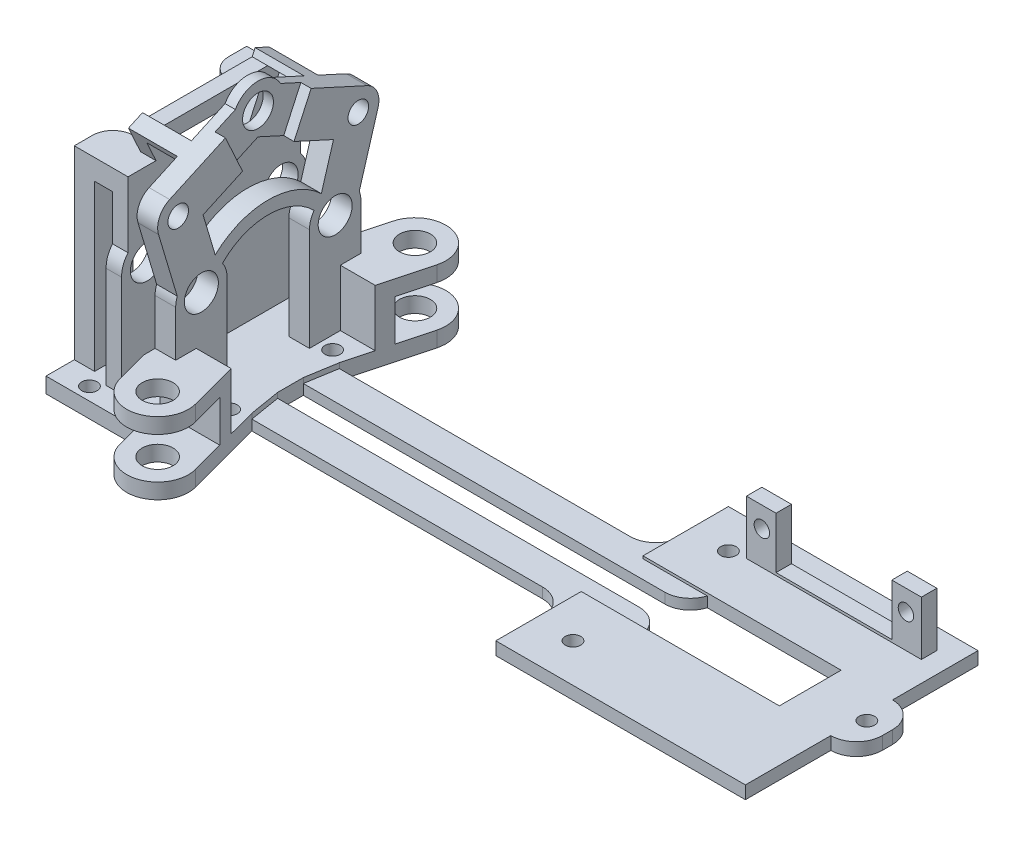
from build123d import *

# Parameters (mm, degrees)
SKETCH1_R            = 1.5
SKETCH1_R_2          = 3
BOSS_EXTRUDE1_DEPTH  = 2
BOSS_EXTRUDE2_START  = -0.5
SKETCH2_R            = 1.5
SKETCH2_W            = 34
SKETCH2_H            = 3
SKETCH2_W_2          = 5.75
SKETCH2_W_3          = 22.5
BOSS_EXTRUDE2_DEPTH  = 0.5
SKETCH3_R            = 1.5
BOSS_EXTRUDE3_DEPTH  = 3
SKETCH6_R            = 3
SKETCH6_R_2          = 1.5
BOSS_EXTRUDE4_DEPTH  = 1
SKETCH7_R            = 3
BOSS_EXTRUDE5_DEPTH  = 11
SKETCH9_R            = 3.299457731
SKETCH9_R_2          = 2
SKETCH9_R_3          = 3
BOSS_EXTRUDE6_DEPTH  = 4
CUT_EXTRUDE1_DEPTH   = 2
BOSS_EXTRUDE7_START  = -3
SKETCH12_R           = 3.299457731
BOSS_EXTRUDE7_DEPTH  = 3
BOSS_EXTRUDE9_DEPTH  = 6.5
CUT_EXTRUDE2_START   = -4
SKETCH15_W           = 14
SKETCH15_H           = 8
SKETCH15_W_2         = 14.00000009
CUT_EXTRUDE2_DEPTH   = 13.5
SKETCH16_W           = 3.943181185
SKETCH16_H           = 7.5
BOSS_EXTRUDE10_DEPTH = 36
FILLET1_R            = 4
BOSS_EXTRUDE11_REACH = 148.52
SKETCH17_W           = 7.5
SKETCH17_H           = 4


with BuildPart() as part:
    # Sketch1 → Boss-Extrude1 (new body)
    with BuildSketch(Plane(origin=(0, 0, 0), x_dir=(1, 0, 0), z_dir=(0, 1, 0))):
        with BuildLine():
            Line((86.813354305, -22.599999955), (86.813354305, -5.999999955))
            ThreePointArc((86.813354305, -5.999999955), (90.34888821, -4.535533861), (91.813354305, -0.999999955))
            Line((91.813354305, -0.999999955), (91.813354305, 1.000000045))
            ThreePointArc((91.813354305, 1.000000045), (90.34888821, 4.535533951), (86.813354305, 6.000000045))
            Line((86.813354305, 6.000000045), (86.813354305, 22.600000045))
            Line((86.813354305, 22.600000045), (38.313354305, 22.600000045))
            Line((38.313354305, 22.600000045), (38.313354305, 13.500000045))
            ThreePointArc((38.313354305, 13.500000045), (36.84888821, 9.964466139), (33.313354305, 8.500000045))
            Line((33.313354305, 8.500000045), (-23.190949615, 8.500000045))
            Line((-23.190949615, 8.500000045), (-19.202650159, 23.453799921))
            ThreePointArc((-19.202650159, 23.453799921), (-23.453799876, 30.797349886), (-30.797349841, 26.546200169))
            Line((-30.797349841, 26.546200169), (-31.943181185, 22.250000045))
            Line((-31.943181185, 22.250000045), (-49.443181185, 22.250000045))
            Line((-49.443181185, 22.250000045), (-49.443181185, 9.250000045))
            Line((-49.443181185, 9.250000045), (-45.5, 9.250000045))
            Line((-45.5, 9.250000045), (-45.5, 11.250000045))
            Line((-45.5, 11.250000045), (-42, 11.250000045))
            Line((-42, 11.250000045), (-42, -11.249999955))
            Line((-42, -11.249999955), (-45.5, -11.249999955))
            Line((-45.5, -11.249999955), (-45.5, -9.249999955))
            Line((-45.5, -9.249999955), (-49.443181185, -9.249999955))
            Line((-49.443181185, -9.249999955), (-49.443181185, -22.249999955))
            Line((-49.443181185, -22.249999955), (-31.943181185, -22.249999955))
            Line((-31.943181185, -22.249999955), (-30.797349841, -26.546200079))
            ThreePointArc((-30.797349841, -26.546200079), (-23.453799876, -30.797349796), (-19.202650159, -23.453799831))
            Line((-19.202650159, -23.453799831), (-23.190949615, -8.499999955))
            Line((-23.190949615, -8.499999955), (33.313354305, -8.499999955))
            ThreePointArc((33.313354305, -8.499999955), (36.84888821, -9.964466049), (38.313354305, -13.499999955))
            Line((38.313354305, -13.499999955), (38.313354305, -22.599999955))
            Line((38.313354305, -22.599999955), (86.813354305, -22.599999955))
        make_face()
        with Locations(Location((-26, -9.999999955, 0), (0, 0, 90))):
            Circle(SKETCH1_R, mode=Mode.SUBTRACT)
        with Locations(Location((87.813354305, 4.5e-08, 0), (0, 0, 270))):
            Circle(SKETCH1_R, mode=Mode.SUBTRACT)
        with Locations(Location((45.813354305, -15.099999955, 0), (0, 0, 270))):
            Circle(SKETCH1_R, mode=Mode.SUBTRACT)
        with Locations(Location((45.813354305, 15.100000045, 0), (0, 0, 270))):
            Circle(SKETCH1_R, mode=Mode.SUBTRACT)
        with Locations(Location((-43.5, 19.750000045, 0), (0, 0, 270))):
            Circle(SKETCH1_R, mode=Mode.SUBTRACT)
        with Locations(Location((-43.5, -19.749999955, 0), (0, 0, 270))):
            Circle(SKETCH1_R, mode=Mode.SUBTRACT)
        with Locations(Location((-25, 25.000000045, 0), (0, 0, 270))):
            Circle(SKETCH1_R_2, mode=Mode.SUBTRACT)
        with Locations(Location((-26, 10.000000045, 0), (0, 0, 270))):
            Circle(SKETCH1_R, mode=Mode.SUBTRACT)
        with Locations(Location((-25, -24.999999955, 0), (0, 0, 270))):
            Circle(SKETCH1_R_2, mode=Mode.SUBTRACT)
        with BuildLine():
            Line((-24.186645695, -2.499999955), (-24.186645695, 2.500000045))
            Line((-24.186645695, 2.500000045), (46.043658297, 2.500000045))
            ThreePointArc((46.043658297, 2.500000045), (49.001698189, 3.468871171), (50.813354305, 6.000000045))
            Line((50.813354305, 6.000000045), (76.813354305, 6.000000045))
            Line((76.813354305, 6.000000045), (76.813354305, -5.999999955))
            Line((76.813354305, -5.999999955), (50.813354305, -5.999999955))
            ThreePointArc((50.813354305, -5.999999955), (49.001698189, -3.468871081), (46.043658297, -2.499999955))
            Line((46.043658297, -2.499999955), (-24.186645695, -2.499999955))
        make_face(mode=Mode.SUBTRACT)
    extrude(amount=BOSS_EXTRUDE1_DEPTH)

    # Sketch2 → Boss-Extrude2 (add)
    # profile 1 of 4: a face of its own
    with BuildSketch(Plane(origin=(0, 2.5, 0), x_dir=(1, 0, 0), z_dir=(0, 1, 0)).offset(BOSS_EXTRUDE2_START)):
        with BuildLine():
            Line((86.813354305, -22.599999955), (86.813354305, -5.999999955))
            ThreePointArc((86.813354305, -5.999999955), (90.34888821, -4.535533861), (91.813354305, -0.999999955))
            Line((91.813354305, -0.999999955), (91.813354305, 1.000000045))
            ThreePointArc((91.813354305, 1.000000045), (90.34888821, 4.535533951), (86.813354305, 6.000000045))
            Line((86.813354305, 6.000000045), (86.813354305, 22.600000045))
            Line((86.813354305, 22.600000045), (38.313354305, 22.600000045))
            Line((38.313354305, 22.600000045), (38.313354305, 6.000000045))
            Line((38.313354305, 6.000000045), (76.813354305, 6.000000045))
            Line((76.813354305, 6.000000045), (76.813354305, -5.999999955))
            Line((76.813354305, -5.999999955), (38.313354305, -5.999999955))
            Line((38.313354305, -5.999999955), (38.313354305, -22.599999955))
            Line((38.313354305, -22.599999955), (86.813354305, -22.599999955))
        make_face()
        with Locations(Location((45.813354305, 15.100000045, 0), (0, 0, 270))):
            Circle(SKETCH2_R, mode=Mode.SUBTRACT)
        with Locations(Location((45.813354305, -15.099999955, 0), (0, 0, 270))):
            Circle(SKETCH2_R, mode=Mode.SUBTRACT)
        with Locations(Location((87.813354305, 4.5e-08, 0), (0, 0, 270))):
            Circle(SKETCH2_R, mode=Mode.SUBTRACT)
        with Locations((65.813354305, 17.100000045)):
            Rectangle(SKETCH2_W, SKETCH2_H, mode=Mode.SUBTRACT)
    # profile 2 of 4: a face of its own
    with BuildSketch(Plane(origin=(0, 2.5, 0), x_dir=(1, 0, 0), z_dir=(0, 1, 0)).offset(BOSS_EXTRUDE2_START)):
        with Locations((51.688354305, 17.100000045)):
            Rectangle(SKETCH2_W_2, SKETCH2_H)
    # profile 3 of 4: a face of its own
    with BuildSketch(Plane(origin=(0, 2.5, 0), x_dir=(1, 0, 0), z_dir=(0, 1, 0)).offset(BOSS_EXTRUDE2_START)):
        with Locations((65.813354305, 17.100000045)):
            Rectangle(SKETCH2_W_3, SKETCH2_H)
    # profile 4 of 4: a face of its own
    with BuildSketch(Plane(origin=(0, 2.5, 0), x_dir=(1, 0, 0), z_dir=(0, 1, 0)).offset(BOSS_EXTRUDE2_START)):
        with Locations((79.938354305, 17.100000045)):
            Rectangle(SKETCH2_W_2, SKETCH2_H)
    extrude(amount=BOSS_EXTRUDE2_DEPTH)

    # Sketch3 → Boss-Extrude3 (add)
    with BuildSketch(Plane.XY.offset(-15.600000045)):
        Polygon((48.813354305, 2.5), (48.813354305, 13), (54.563354305, 13), (54.563354305, 3), (77.063354305, 3), (77.063354305, 13), (82.813354305, 13), (82.813354305, 2.5), align=None)
        with Locations((51.813354305, 9)):
            Circle(SKETCH3_R, mode=Mode.SUBTRACT)
        with Locations(Location((79.813354305, 9, 0), (0, 0, 180))):
            Circle(SKETCH3_R, mode=Mode.SUBTRACT)
    extrude(amount=-BOSS_EXTRUDE3_DEPTH)

    # Sketch6 → Boss-Extrude4 (add)
    with BuildSketch(Plane(origin=(0, 2, 0), x_dir=(1, 0, 0), z_dir=(0, 1, 0))):
        with BuildLine():
            Line((-31.943181185, 22.250000045), (-49.443181185, 22.250000045))
            Line((-49.443181185, 22.250000045), (-49.443181185, 9.250000045))
            Line((-49.443181185, 9.250000045), (-45.5, 9.250000045))
            Line((-45.5, 9.250000045), (-45.5, 11.250000045))
            Line((-45.5, 11.250000045), (-42, 11.250000045))
            Line((-42, 11.250000045), (-42, -11.249999955))
            Line((-42, -11.249999955), (-45.5, -11.249999955))
            Line((-45.5, -11.249999955), (-45.5, -9.249999955))
            Line((-45.5, -9.249999955), (-49.443181185, -9.249999955))
            Line((-49.443181185, -9.249999955), (-49.443181185, -22.249999955))
            Line((-49.443181185, -22.249999955), (-31.943181185, -22.249999955))
            Line((-31.943181185, -22.249999955), (-30.797349841, -26.546200079))
            ThreePointArc((-30.797349841, -26.546200079), (-23.453799876, -30.797349796), (-19.202650159, -23.453799831))
            Line((-19.202650159, -23.453799831), (-23.190949615, -8.499999955))
            Line((-23.190949615, -8.499999955), (-24.186645695, -2.499999955))
            Line((-24.186645695, -2.499999955), (-24.186645695, 2.500000045))
            Line((-24.186645695, 2.500000045), (-23.190949615, 8.500000045))
            Line((-23.190949615, 8.500000045), (-19.202650159, 23.453799921))
            ThreePointArc((-19.202650159, 23.453799921), (-23.453799876, 30.797349886), (-30.797349841, 26.546200169))
            Line((-30.797349841, 26.546200169), (-31.943181185, 22.250000045))
        make_face()
        with Locations(Location((-25, -24.999999955, 0), (0, 0, 270))):
            Circle(SKETCH6_R, mode=Mode.SUBTRACT)
        with Locations(Location((-25, 25.000000045, 0), (0, 0, 270))):
            Circle(SKETCH6_R, mode=Mode.SUBTRACT)
        with Locations(Location((-43.5, 19.750000045, 0), (0, 0, 270))):
            Circle(SKETCH6_R_2, mode=Mode.SUBTRACT)
        with Locations(Location((-26, 10.000000045, 0), (0, 0, 270))):
            Circle(SKETCH6_R_2, mode=Mode.SUBTRACT)
        with Locations(Location((-43.5, -19.749999955, 0), (0, 0, 270))):
            Circle(SKETCH6_R_2, mode=Mode.SUBTRACT)
        with Locations(Location((-26, -9.999999955, 0), (0, 0, 90))):
            Circle(SKETCH6_R_2, mode=Mode.SUBTRACT)
    extrude(amount=BOSS_EXTRUDE4_DEPTH)

    # Sketch7 → Boss-Extrude5 (add)
    # profile 1 of 2: a face of its own
    with BuildSketch(Plane(origin=(0, 3, 0), x_dir=(1, 0, 0), z_dir=(0, 1, 0))):
        with BuildLine():
            Line((-32.5, -20.162253733), (-30.797349841, -26.546200079))
            ThreePointArc((-30.797349841, -26.546200079), (-23.453799876, -30.797349796), (-19.202650159, -23.453799831))
            Line((-19.202650159, -23.453799831), (-21.724055101, -13.999999955))
            Line((-21.724055101, -13.999999955), (-32.5, -13.999999955))
            Line((-32.5, -13.999999955), (-32.5, -20.162253733))
        make_face()
        with Locations(Location((-25, -24.999999955, 0), (0, 0, 270))):
            Circle(SKETCH7_R, mode=Mode.SUBTRACT)
    # profile 2 of 2: a face of its own
    with BuildSketch(Plane(origin=(0, 3, 0), x_dir=(1, 0, 0), z_dir=(0, 1, 0))):
        with BuildLine():
            ThreePointArc((-19.202650159, 23.453799831), (-23.453799876, 30.797349796), (-30.797349841, 26.546200079))
            Line((-30.797349841, 26.546200079), (-32.5, 20.162253733))
            Line((-32.5, 20.162253733), (-32.5, 13.999999955))
            Line((-32.5, 13.999999955), (-21.724055101, 13.999999955))
            Line((-21.724055101, 13.999999955), (-19.202650159, 23.453799831))
        make_face()
        with Locations(Location((-25, 24.999999955, 0), (0, 0, 270))):
            Circle(SKETCH7_R, mode=Mode.SUBTRACT)
    extrude(amount=BOSS_EXTRUDE5_DEPTH)

    # Sketch9 → Boss-Extrude6 (add)
    # profile 1 of 2: a face of its own
    with BuildSketch(Plane(origin=(-28.5, 0, 0), x_dir=(0, 0, -1), z_dir=(1, 0, 0))):
        with BuildLine():
            ThreePointArc((4.391462468, 48.390618622), (0, 51), (-4.391462468, 48.390618622))
            Line((-4.391462468, 48.390618622), (-19.163039041, 41.637897902))
            ThreePointArc((-19.163039041, 41.637897902), (-21.155867973, 39.623154141), (-21.313780308, 36.793733128))
            Line((-21.313780308, 36.793733128), (-17.688403338, 24.634858064))
            ThreePointArc((-17.688403338, 24.634858064), (-17.918788103, 23.784948803), (-17.99638647, 22.907793522))
            Line((-17.99638647, 22.907793522), (-17.99638647, 3))
            Line((-17.99638647, 3), (-7.997718525, 3))
            Line((-7.997718525, 3), (-7.997718525, 22.974457006))
            ThreePointArc((-7.997718525, 22.974457006), (-8.238722354, 24.4432085), (-8.901175531, 25.776051172))
            ThreePointArc((-8.901175531, 25.776051172), (-9.416150503, 26.398250048), (-10.024537801, 26.929470869))
            Line((-10.024537801, 26.929470869), (-10.311923406, 27.89331151))
            Line((-10.311923406, 27.89331151), (-12.67209162, 35.80889951))
            Line((-12.67209162, 35.80889951), (0, 41.601855679))
            Line((0, 41.601855679), (12.67209162, 35.80889951))
            Line((12.67209162, 35.80889951), (10.311923406, 27.89331151))
            Line((10.311923406, 27.89331151), (10.024537801, 26.929470869))
            ThreePointArc((10.024537801, 26.929470869), (9.416150503, 26.398250048), (8.901175531, 25.776051172))
            ThreePointArc((8.901175531, 25.776051172), (8.238722354, 24.4432085), (7.997718525, 22.974457006))
            Line((7.997718525, 22.974457006), (7.997718525, 3))
            Line((7.997718525, 3), (17.99638647, 3))
            Line((17.99638647, 3), (17.99638647, 22.907793522))
            ThreePointArc((17.99638647, 22.907793522), (17.918788103, 23.784948803), (17.688403338, 24.634858064))
            Line((17.688403338, 24.634858064), (21.313780308, 36.793733128))
            ThreePointArc((21.313780308, 36.793733128), (21.155867973, 39.623154141), (19.163039041, 41.637897902))
            Line((19.163039041, 41.637897902), (4.391462468, 48.390618622))
        make_face()
        with Locations((-13, 22.907793522)):
            Circle(SKETCH9_R, mode=Mode.SUBTRACT)
        with Locations((13, 22.907793522)):
            Circle(SKETCH9_R, mode=Mode.SUBTRACT)
        with Locations((-17.5, 38)):
            Circle(SKETCH9_R_2, mode=Mode.SUBTRACT)
        with Locations((17.5, 38)):
            Circle(SKETCH9_R_2, mode=Mode.SUBTRACT)
        with Locations((0, 46)):
            Circle(SKETCH9_R_3, mode=Mode.SUBTRACT)
    # profile 2 of 2: a face of its own
    with BuildSketch(Plane(origin=(-28.5, 0, 0), x_dir=(0, 0, -1), z_dir=(1, 0, 0))):
        with BuildLine():
            ThreePointArc((-10.024537801, 26.929470869), (-9.416150503, 26.398250048), (-8.901175531, 25.776051172))
            ThreePointArc((-8.901175531, 25.776051172), (0, 29.5), (8.901175531, 25.776051172))
            ThreePointArc((8.901175531, 25.776051172), (9.416150503, 26.398250048), (10.024537801, 26.929470869))
            Line((10.024537801, 26.929470869), (10.311923406, 27.89331151))
            ThreePointArc((10.311923406, 27.89331151), (0, 32), (-10.311923406, 27.89331151))
            Line((-10.311923406, 27.89331151), (-10.024537801, 26.929470869))
        make_face()
    extrude(amount=-BOSS_EXTRUDE6_DEPTH)

    # Sketch10 → Cut-Extrude1 (cut)
    with BuildSketch(Plane(origin=(-28.5, 0, 0), x_dir=(0, 0, -1), z_dir=(1, 0, 0))):
        with BuildLine():
            ThreePointArc((4.391462468, 48.390618622), (0, 51), (-4.391462468, 48.390618622))
            Line((-4.391462468, 48.390618622), (-8.326078082, 46.591937198))
            Line((-8.326078082, 46.591937198), (-5, 39.316141393))
            Line((-5, 39.316141393), (0, 41.601855679))
            Line((0, 41.601855679), (5, 39.316141393))
            Line((5, 39.316141393), (8.326078082, 46.591937198))
            Line((8.326078082, 46.591937198), (4.391462468, 48.390618622))
        make_face()
    extrude(amount=-CUT_EXTRUDE1_DEPTH, mode=Mode.SUBTRACT)

    # Sketch12 → Boss-Extrude7 (add)
    # profile 1 of 4: a face of its own
    with BuildSketch(Plane.ZY.offset(42).offset(BOSS_EXTRUDE7_START)):
        with BuildLine():
            Line((-17.99638647, 22.717735009), (-17.99638647, 3))
            Line((-17.99638647, 3), (-11.250000045, 3))
            Line((-11.250000045, 3), (-8, 3))
            Line((-8, 3), (-8, 22.907793522))
            ThreePointArc((-8, 22.907793522), (-8.231122016, 24.410392196), (-8.90312111, 25.774077416))
            ThreePointArc((-8.90312111, 25.774077416), (0, 29.5), (8.90312111, 25.774077416))
            ThreePointArc((8.90312111, 25.774077416), (8.231122016, 24.410392196), (8, 22.907793522))
            Line((8, 22.907793522), (8, 3))
            Line((8, 3), (11.249999955, 3))
            Line((11.249999955, 3), (17.99638647, 3))
            Line((17.99638647, 3), (17.99638647, 22.717735009))
            ThreePointArc((17.99638647, 22.717735009), (17.709830597, 24.58633329), (16.749999955, 26.214982712))
            ThreePointArc((16.749999955, 26.214982712), (13.979101343, 27.810992535), (10.807745328, 27.401569157))
            ThreePointArc((10.807745328, 27.401569157), (9.135196882, 28.89740215), (7.258225684, 30.127001178))
            Line((7.258225684, 30.127001178), (11.314453717, 39))
            Line((11.314453717, 39), (13.668579759, 44.149650717))
            Line((13.668579759, 44.149650717), (10.940156332, 45.396929998))
            Line((10.940156332, 45.396929998), (10.369971518, 44.149650717))
            Line((10.369971518, 44.149650717), (-10.369971518, 44.149650717))
            Line((-10.369971518, 44.149650717), (-10.940156332, 45.396929998))
            Line((-10.940156332, 45.396929998), (-13.668579759, 44.149650717))
            Line((-13.668579759, 44.149650717), (-11.314453717, 39))
            Line((-11.314453717, 39), (-7.258225684, 30.127001178))
            ThreePointArc((-7.258225684, 30.127001178), (-9.135196882, 28.89740215), (-10.807745328, 27.401569157))
            ThreePointArc((-10.807745328, 27.401569157), (-13.979101409, 27.810992522), (-16.750000045, 26.21498261))
            ThreePointArc((-16.750000045, 26.21498261), (-17.70983062, 24.586333226), (-17.99638647, 22.717735009))
        make_face()
        with Locations(Location((-13, 22.907793522, 0), (0, 0, 180))):
            Circle(SKETCH12_R, mode=Mode.SUBTRACT)
        with Locations(Location((13, 22.907793522, 0), (0, 0, 180))):
            Circle(SKETCH12_R, mode=Mode.SUBTRACT)
        with BuildLine():
            Line((-8.998542947, 41.149650717), (8.998542947, 41.149650717))
            Line((8.998542947, 41.149650717), (4.5, 31.309088021))
            ThreePointArc((4.5, 31.309088021), (0, 32), (-4.5, 31.309088021))
            Line((-4.5, 31.309088021), (-8.998542947, 41.149650717))
        make_face(mode=Mode.SUBTRACT)
    # profile 2 of 4: a face of its own
    with BuildSketch(Plane.ZY.offset(42).offset(BOSS_EXTRUDE7_START)):
        with BuildLine():
            Line((-8, 22.907793522), (-8, 3))
            Line((-8, 3), (8, 3))
            Line((8, 3), (8, 22.907793522))
            ThreePointArc((8, 22.907793522), (8.231122016, 24.410392196), (8.90312111, 25.774077416))
            ThreePointArc((8.90312111, 25.774077416), (0, 29.5), (-8.90312111, 25.774077416))
            ThreePointArc((-8.90312111, 25.774077416), (-8.231122016, 24.410392196), (-8, 22.907793522))
        make_face()
    # profile 3 of 4: a face of its own
    with BuildSketch(Plane.ZY.offset(42).offset(BOSS_EXTRUDE7_START)):
        with BuildLine():
            Line((-16.750000045, 39), (-16.750000045, 26.21498261))
            ThreePointArc((-16.750000045, 26.21498261), (-13.979101409, 27.810992522), (-10.807745328, 27.401569157))
            ThreePointArc((-10.807745328, 27.401569157), (-9.135196882, 28.89740215), (-7.258225684, 30.127001178))
            Line((-7.258225684, 30.127001178), (-11.314453717, 39))
            Line((-11.314453717, 39), (-16.750000045, 39))
        make_face()
    # profile 4 of 4: a face of its own
    with BuildSketch(Plane.ZY.offset(42).offset(BOSS_EXTRUDE7_START)):
        with BuildLine():
            ThreePointArc((10.807745328, 27.401569157), (13.979101343, 27.810992535), (16.749999955, 26.214982712))
            Line((16.749999955, 26.214982712), (16.749999955, 39))
            Line((16.749999955, 39), (11.314453717, 39))
            Line((11.314453717, 39), (7.258225684, 30.127001178))
            ThreePointArc((7.258225684, 30.127001178), (9.135196882, 28.89740215), (10.807745328, 27.401569157))
        make_face()
    extrude(amount=BOSS_EXTRUDE7_DEPTH)

    # Sketch14 → Boss-Extrude9 (add)
    with BuildSketch(Plane(origin=(-39, 0, 0), x_dir=(0, 0, -1), z_dir=(1, 0, 0))):
        Polygon((10.369971518, 44.149650717), (13.098394945, 42.902371436), (13.668579759, 44.149650717), (10.940156332, 45.396929998), align=None)
        Polygon((-10.369971518, 44.149650717), (-13.098394945, 42.902371436), (-13.668579759, 44.149650717), (-10.940156332, 45.396929998), align=None)
    extrude(amount=BOSS_EXTRUDE9_DEPTH)

    # Sketch15 → Cut-Extrude2 (cut)
    with BuildSketch(Plane(origin=(-28.5, 0, 0), x_dir=(0, 0, -1), z_dir=(1, 0, 0)).offset(CUT_EXTRUDE2_START)):
        with Locations((-23.999999955, 7)):
            Rectangle(SKETCH15_W, SKETCH15_H)
        with Locations((24, 7)):
            Rectangle(SKETCH15_W_2, SKETCH15_H)
    extrude(amount=CUT_EXTRUDE2_DEPTH, mode=Mode.SUBTRACT)

    # Sketch16 → Boss-Extrude10 (add)
    with BuildSketch(Plane(origin=(0, 3, 0), x_dir=(1, 0, 0), z_dir=(0, 1, 0))):
        with Locations((-47.471590593, 13.000000045)):
            Rectangle(SKETCH16_W, SKETCH16_H)
        with Locations((-47.471590593, -12.999999955)):
            Rectangle(SKETCH16_W, SKETCH16_H)
    extrude(amount=BOSS_EXTRUDE10_DEPTH)

    # Fillet1
    # the kernel refuses this fillet: 4 mm, written as the material it takes off along each edge
    with BuildSketch(Plane(origin=(-49.443181185, -10, 9.249999955), x_dir=(1, 0, 0), z_dir=(0, 1, 0)), Plane(origin=(-49.443181185, -10, -9.250000045), x_dir=(0, 0, -1), z_dir=(0, 1, 0))) as fillet1_piece_1:
        with BuildLine():
            CenterArc((FILLET1_R, -FILLET1_R), FILLET1_R, 90, 90)
            Line((0, -FILLET1_R), (0, 0))
            Line((0, 0), (FILLET1_R, 0))
        make_face()
    extrude(amount=59, mode=Mode.SUBTRACT)

    # Boss-Extrude11: up to this face of the body (flat: up to its plane)
    boss_extrude11_end = Plane(part.part.faces().sort_by_distance((-45.5, 20.576148325, -12.940427875))[0])
    # Sketch17 → Boss-Extrude11 (add, up to the picked face)
    with BuildSketch(Plane.ZY.offset(42), mode=Mode.PRIVATE) as boss_extrude11_sk1:
        with Locations((-13.000000045, 37)):
            Rectangle(SKETCH17_W, SKETCH17_H)
    boss_extrude11_tool1 = split(extrude(boss_extrude11_sk1.sketch, amount=BOSS_EXTRUDE11_REACH, mode=Mode.PRIVATE), bisect_by=boss_extrude11_end, keep=Keep.BOTH, mode=Mode.PRIVATE)
    # Sketch17 → Boss-Extrude11 (add, up to the picked face)
    with BuildSketch(Plane.ZY.offset(42), mode=Mode.PRIVATE) as boss_extrude11_sk2:
        with Locations((12.999999955, 37)):
            Rectangle(SKETCH17_W, SKETCH17_H)
    boss_extrude11_tool2 = split(extrude(boss_extrude11_sk2.sketch, amount=BOSS_EXTRUDE11_REACH, mode=Mode.PRIVATE), bisect_by=boss_extrude11_end, keep=Keep.BOTH, mode=Mode.PRIVATE)
    add(boss_extrude11_tool1.solids().sort_by(Axis((-42, 37, -13), (-1, 0, 0)))[0])
    add(boss_extrude11_tool2.solids().sort_by(Axis((-42, 37, 13), (-1, 0, 0)))[0])


solid = part.part
